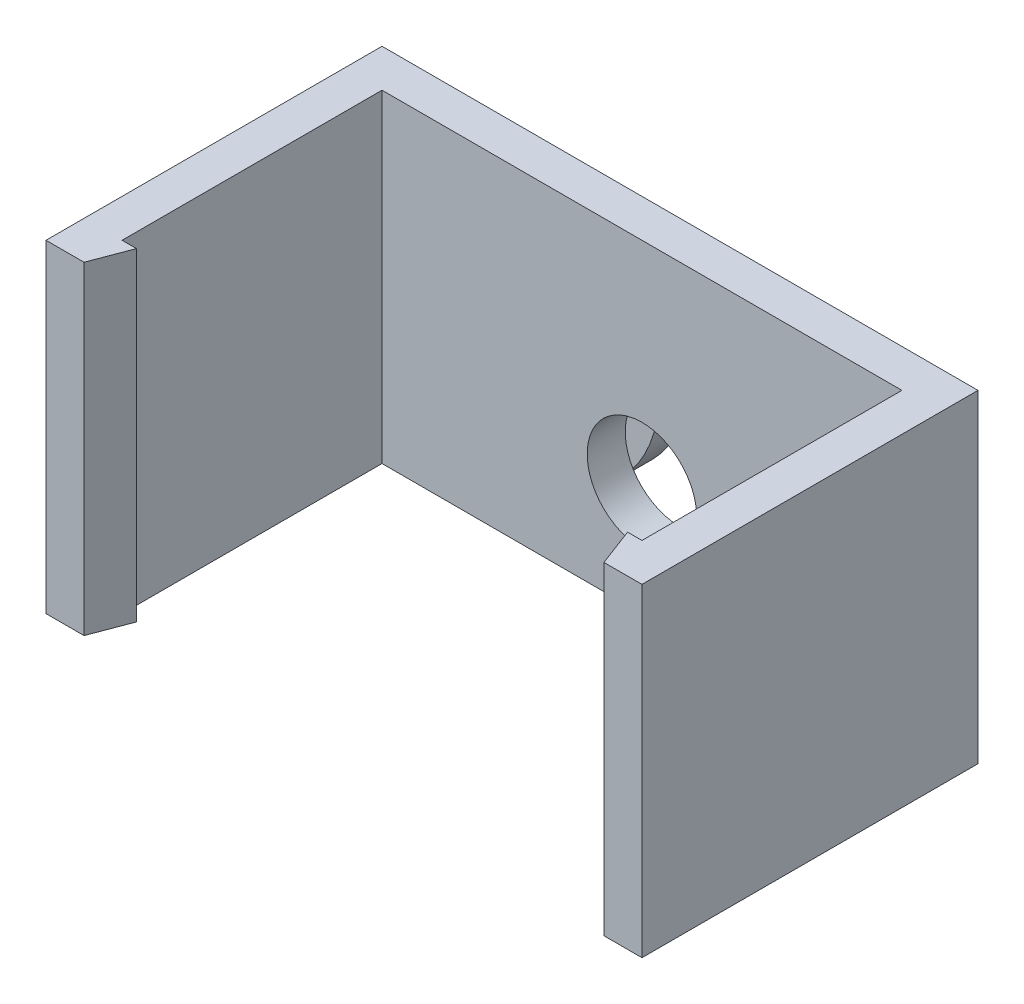
from build123d import *

# Parameters (mm, degrees)
SKETCH1_W               = 47
SKETCH1_H               = 26.5
SKETCH1_W_2             = 41
SKETCH1_H_2             = 20.5
BOSS_EXTRUDE1_DEPTH     = 31
CUT_EXTRUDE2_DEPTH      = 31
SKETCH4_W               = 34.29807853
SKETCH4_H               = 20
BOSS_EXTRUDE2_DEPTH     = 10
SKETCH5_W               = 5
SKETCH5_H               = 17.5
CUT_EXTRUDE3_DEPTH      = 45
CUT_EXTRUDE4_DEPTH      = 64
CUT_EXTRUDE4_DEPTH_BACK = 45
SKETCH6_R               = 4.31945574
SKETCH7_W               = 8.63891148
SKETCH7_H               = 8.75
CUT_EXTRUDE5_DEPTH      = 10
FILLET2_START           = -23.25
FILLET2_DEPTH           = 5
SKETCH8_W               = 26.5
SKETCH8_H               = 5.5
CUT_EXTRUDE6_DEPTH      = 55
BOSS_EXTRUDE3_DEPTH     = 2.4
SKETCH10_W              = 5
SKETCH10_H              = 20
CUT_EXTRUDE7_DEPTH      = 39.4
FILLET4_R               = 5


with BuildPart() as part:
    # Sketch1 → Boss-Extrude1 (new body)
    with BuildSketch(Plane(origin=(0, 0, 0), x_dir=(1, 0, 0), z_dir=(0, 1, 0))):
        Rectangle(SKETCH1_W, SKETCH1_H)
        Rectangle(SKETCH1_W_2, SKETCH1_H_2, mode=Mode.SUBTRACT)
    extrude(amount=BOSS_EXTRUDE1_DEPTH)

    # Sketch3 → Cut-Extrude2 (cut)
    with BuildSketch(Plane(origin=(0, 31, 0), x_dir=(1, 0, 0), z_dir=(0, 1, 0))):
        Polygon((-19.366144394, -10.25), (-20.5, -13.25), (0, -13.25), (0, -10.25), align=None)
        Polygon((0, -10.25), (0, -13.25), (20.5, -13.25), (19.366144394, -10.25), align=None)
    extrude(amount=-CUT_EXTRUDE2_DEPTH, mode=Mode.SUBTRACT)

    # Sketch4 → Boss-Extrude2 (add)
    with BuildSketch(Plane(origin=(0, 0, -13.25), x_dir=(-1, 0, 0), z_dir=(0, 0, -1))):
        with Locations((0, 15.5)):
            Rectangle(SKETCH4_W, SKETCH4_H)
    extrude(amount=BOSS_EXTRUDE2_DEPTH)

    # Sketch5 → Cut-Extrude3 (cut)
    with BuildSketch(Plane(origin=(17.149039265, 0, 0), x_dir=(0, 0, -1), z_dir=(1, 0, 0))):
        with Locations((15.75, 14.25)):
            Rectangle(SKETCH5_W, SKETCH5_H)
    extrude(amount=-CUT_EXTRUDE3_DEPTH, mode=Mode.SUBTRACT)

    # Sketch6 → Cut-Extrude4 (cut, two sides: drawn at the far end of the back side and taken through both)
    with BuildSketch(Plane.XY.offset(-18.25).offset(-CUT_EXTRUDE4_DEPTH_BACK)):
        with Locations(Location((0, 14.25, 0), (0, 0, 180))):
            Circle(SKETCH6_R)
    extrude(amount=CUT_EXTRUDE4_DEPTH + CUT_EXTRUDE4_DEPTH_BACK, mode=Mode.SUBTRACT)

    # Sketch7 → Cut-Extrude5 (cut)
    with BuildSketch(Plane(origin=(0, 0, -23.25), x_dir=(-1, 0, 0), z_dir=(0, 0, -1))):
        with Locations((0, 9.875)):
            Rectangle(SKETCH7_W, SKETCH7_H)
    extrude(amount=-CUT_EXTRUDE5_DEPTH, mode=Mode.SUBTRACT)

    # Fillet2: read off the stored shape, not the designer's step
    # Fillet2 outline → Fillet2 (cut)
    with BuildSketch(Plane.XY.offset(FILLET2_START)):
        with BuildLine():
            ThreePointArc((-4.31945574, 14.25), (-4.315331507, 14.438711079), (-4.302966685, 14.627061794))
            ThreePointArc((-4.302966685, 14.627061794), (-7.509401663, 8.126758445), (-14.264792768, 5.5))
            Line((-14.264792768, 5.5), (-4.31945574, 5.5))
            Line((-4.31945574, 5.5), (-4.31945574, 14.25))
        make_face()
        with BuildLine():
            ThreePointArc((14.264792768, 5.5), (7.509401663, 8.126758445), (4.302966685, 14.627061794))
            ThreePointArc((4.302966685, 14.627061794), (4.315331507, 14.438711079), (4.31945574, 14.25))
            Line((4.31945574, 14.25), (4.31945574, 5.5))
            Line((4.31945574, 5.5), (14.264792768, 5.5))
        make_face()
    extrude(amount=FILLET2_DEPTH, mode=Mode.SUBTRACT)

    # Sketch8 → Cut-Extrude6 (cut)
    with BuildSketch(Plane(origin=(23.5, 0, 0), x_dir=(0, 0, -1), z_dir=(1, 0, 0))):
        with Locations((0, 2.75)):
            Rectangle(SKETCH8_W, SKETCH8_H)
    extrude(amount=-CUT_EXTRUDE6_DEPTH, mode=Mode.SUBTRACT)

    # Sketch9 → Boss-Extrude3 (add)
    with BuildSketch(Plane.XY.offset(-18.25)):
        with BuildLine():
            Line((-17.149039265, 23), (17.149039265, 23))
            Line((17.149039265, 23), (17.149039265, 5.5))
            Line((17.149039265, 5.5), (14.264792768, 5.5))
            ThreePointArc((14.264792768, 5.5), (7.509401663, 8.126758445), (4.302966685, 14.627061794))
            ThreePointArc((4.302966685, 14.627061794), (0, 18.56945574), (-4.302966685, 14.627061794))
            ThreePointArc((-4.302966685, 14.627061794), (-7.509401663, 8.126758445), (-14.264792768, 5.5))
            Line((-14.264792768, 5.5), (-17.149039265, 5.5))
            Line((-17.149039265, 5.5), (-17.149039265, 23))
        make_face()
    extrude(amount=BOSS_EXTRUDE3_DEPTH)

    # Sketch10 → Cut-Extrude7 (cut)
    with BuildSketch(Plane(origin=(17.149039265, 0, 0), x_dir=(0, 0, -1), z_dir=(1, 0, 0))):
        with Locations((20.75, 15.5)):
            Rectangle(SKETCH10_W, SKETCH10_H)
    extrude(amount=-CUT_EXTRUDE7_DEPTH, mode=Mode.SUBTRACT)

    # Fillet4
    fillet4_edges = [part.edges().sort_by_distance(p)[0] for p in [
        (0, 25.5, -13.25),
    ]]
    fillet(fillet4_edges, radius=FILLET4_R - 0.0001)  # a hair under: the kernel refuses the full size


solid = part.part
